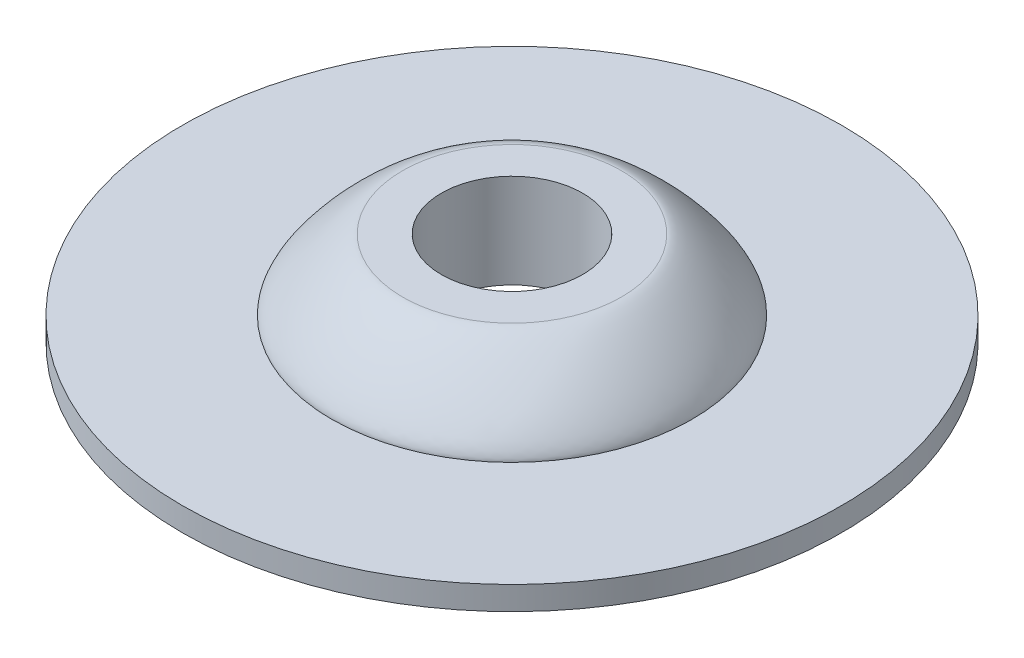
from build123d import *

# Parameters (mm, degrees)
ESQUISSE1_R        = 14
ESQUISSE1_R_2      = 3
BOSS_EXTRU_1_DEPTH = 1
ESQUISSE2_R        = 7.65
ESQUISSE2_R_2      = 3
BOSS_EXTRU_2_DEPTH = 3
CONG_1_SIZE        = 3


with BuildPart() as part:
    # Esquisse1 → Boss.-Extru.1 (new body)
    with BuildSketch(Plane(origin=(0, 0, 0), x_dir=(1, 0, 0), z_dir=(0, 1, 0))):
        with Locations(Location((0, 0, 0), (0, 0, 270))):
            Circle(ESQUISSE1_R)
        with Locations(Location((0, 0, 0), (0, 0, 270))):
            Circle(ESQUISSE1_R_2, mode=Mode.SUBTRACT)
    extrude(amount=BOSS_EXTRU_1_DEPTH)

    # Esquisse2 → Boss.-Extru.2 (add)
    with BuildSketch(Plane(origin=(0, 1, 0), x_dir=(1, 0, 0), z_dir=(0, 1, 0))):
        with Locations(Location((0, 0, 0), (0, 0, 270))):
            Circle(ESQUISSE2_R)
        with Locations(Location((0, 0, 0), (0, 0, 270))):
            Circle(ESQUISSE2_R_2, mode=Mode.SUBTRACT)
    extrude(amount=BOSS_EXTRU_2_DEPTH)

    # Congé1
    # a fillet whose section is not a circle: 3 mm, written as the material it takes off along each edge
    with BuildSketch(Plane(origin=(0, 4, 0), x_dir=(0, 0, 1), z_dir=(-1, 0, 0))) as cong_1_piece_1:
        with BuildLine():
            Bezier((7.65, -CONG_1_SIZE), (7.65, 0), (7.65 - CONG_1_SIZE, 0), weights=[1, 0.212132034, 1])
            Line((7.65 - CONG_1_SIZE, 0), (7.65, 0))
            Line((7.65, 0), (7.65, -CONG_1_SIZE))
        make_face()
    revolve(axis=Axis((0, 4, 0), (0, 1, 0)), mode=Mode.SUBTRACT)


solid = part.part
